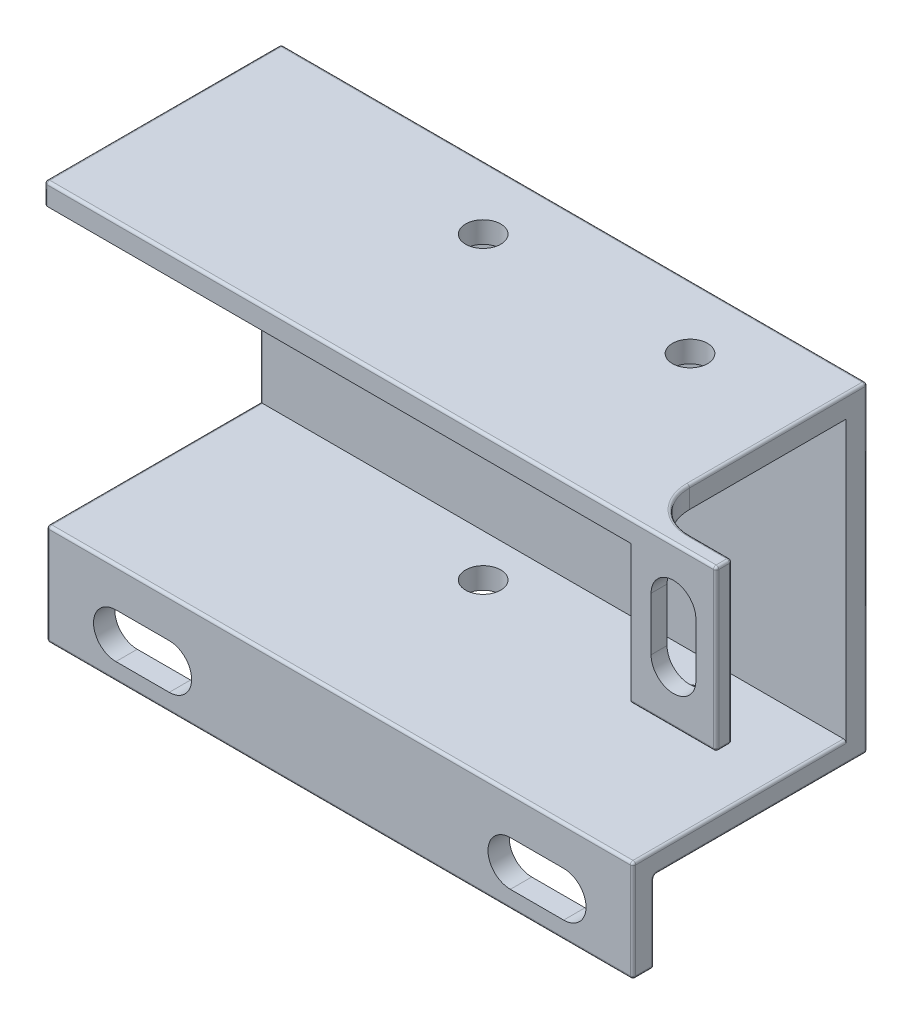
from build123d import *

# Parameters (mm, degrees)
EXTRUDE_THIN2_DEPTH     = 27.5
CUT_EXTRUDE4_DEPTH      = 46.053967639
CUT_EXTRUDE4_DEPTH_BACK = 46.053967639
SKETCH6_R               = 1.65
SKETCH8_W               = 8
SKETCH8_H               = 15
BOSS_EXTRUDE1_DEPTH     = 1.5
CUT_EXTRUDE5_DEPTH      = 1.5
FILLET2_R               = 4
FILLET3_R               = 0.25
CUT_EXTRUDE7_DEPTH      = 10
FILLET5_R               = 1


with BuildPart() as part:
    # Sketch1 → Extrude-Thin2 (new, symmetric)
    with BuildSketch(Plane(origin=(0, 0, 0), x_dir=(0, 0, -1), z_dir=(1, 0, 0))):
        Polygon((-0.2, 26.1), (20, 26.1), (20, 0), (0, 0), (0, -9.5), (2, -9.5), (2, -2), (22, -2), (22, 28.1), (-0.2, 28.1), align=None)
    extrude(amount=EXTRUDE_THIN2_DEPTH, both=True)

    # Sketch6 → Cut-Extrude4 (cut, two sides: drawn at the far end of the back side and taken through both)
    with BuildSketch(Plane(origin=(0, 0, 0), x_dir=(1, 0, 0), z_dir=(0, 1, 0)).offset(-CUT_EXTRUDE4_DEPTH_BACK)):
        with Locations(Location((-2.55, 16, 0), (0, 0, 270))):
            Circle(SKETCH6_R)
        with Locations(Location((16.85, 16, 0), (0, 0, 270))):
            Circle(SKETCH6_R)
    extrude(amount=CUT_EXTRUDE4_DEPTH + CUT_EXTRUDE4_DEPTH_BACK, mode=Mode.SUBTRACT)

    # Sketch8 → Boss-Extrude1 (add)
    with BuildSketch(Plane.XY.offset(0.2)):
        with Locations((31.5, 20.6)):
            Rectangle(SKETCH8_W, SKETCH8_H)
    extrude(amount=-BOSS_EXTRUDE1_DEPTH)

    # Sketch9 → Cut-Extrude5 (cut)
    with BuildSketch(Plane(origin=(0, 0, 0.2), x_dir=(-1, 0, 0), z_dir=(0, 0, -1))):
        with BuildLine():
            Line((-29.4, 18), (-29.4, 23))
            ThreePointArc((-29.4, 23), (-31.5, 25.1), (-33.6, 23))
            Line((-33.6, 23), (-33.6, 18))
            ThreePointArc((-33.6, 18), (-31.5, 15.9), (-29.4, 18))
        make_face()
    extrude(amount=CUT_EXTRUDE5_DEPTH, mode=Mode.SUBTRACT)

    # Fillet2
    fillet2_edges = [part.edges().sort_by_distance(p)[0] for p in [
        (27.5, 27.1, -1.3),
    ]]
    fillet(fillet2_edges, radius=FILLET2_R)

    # Fillet3
    fillet3_edges = [part.edges().sort_by_distance(p)[0] for p in [
        (-27.5, -4.75, 0),
        (-27.5, 0, -10),
        (-27.5, 13.05, -20),
        (-27.5, 26.1, -9.9),
        (-27.5, 27.1, 0.2),
        (-27.5, 28.1, -10.9),
        (0, 28.1, -22),
        (0, -2, -22),
        (0, -2, -2),
        (0, -9.5, -2),
        (0, -9.5, 0),
        (0, 0, 0),
        (4, 28.1, 0.2),
        (27.5, 0, -10),
        (27.5, -4.75, 0),
        (27.5, -9.5, -1),
        (27.5, -5.75, -2),
        (27.5, -2, -12),
        (27.5, 13.05, -22),
        (33.5, 28.1, -1.3),
        (35.5, 20.6, -1.3),
        (35.5, 28.1, -0.55),
        (31.5, 13.1, -1.3),
        (35.5, 13.1, -0.55),
        (31.5, 13.1, 0.2),
        (35.5, 20.6, 0.2),
        (27.5, 28.1, -13.65),
        (28.671572875, 28.1, -2.471572875),
        (-27.5, 13.05, -22),
        (-27.5, -2, -12),
        (-27.5, -5.75, -2),
        (-27.5, -9.5, -1),
    ]]
    fillet(fillet3_edges, radius=FILLET3_R)

    # Sketch11 → Cut-Extrude7 (cut)
    with BuildSketch(Plane(origin=(0, 0, -2), x_dir=(-1, 0, 0), z_dir=(0, 0, -1))):
        with BuildLine():
            Line((-21, -7.85), (-16, -7.85))
            ThreePointArc((-16, -7.85), (-13.9, -5.75), (-16, -3.65))
            Line((-16, -3.65), (-21, -3.65))
            ThreePointArc((-21, -3.65), (-23.1, -5.75), (-21, -7.85))
        make_face()
        with BuildLine():
            Line((16, -3.65), (21, -3.65))
            ThreePointArc((21, -3.65), (23.1, -5.75), (21, -7.85))
            Line((21, -7.85), (16, -7.85))
            ThreePointArc((16, -7.85), (13.9, -5.75), (16, -3.65))
        make_face()
    extrude(amount=-CUT_EXTRUDE7_DEPTH, mode=Mode.SUBTRACT)

    # Fillet5
    fillet5_edges = [part.edges().sort_by_distance(p)[0] for p in [
        (29.5, 26.1, -1.3),
    ]]
    fillet(fillet5_edges, radius=FILLET5_R - 0.0001)  # a hair under: the kernel refuses the full size


solid = part.part
